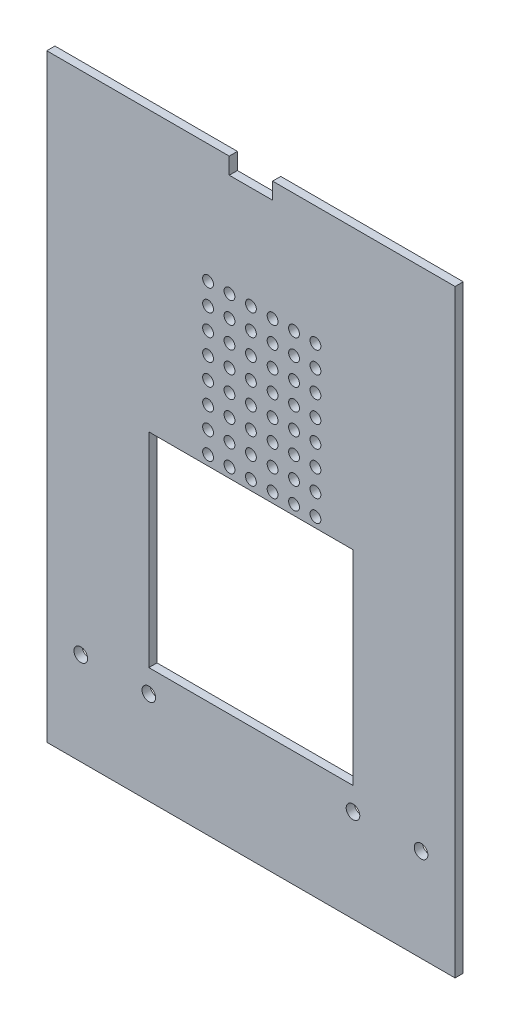
from build123d import *

# Parameters (mm, degrees)
SKETCH1_W           = 152.4
SKETCH1_H           = 292.1
BOSS_EXTRUDE1_DEPTH = 3.048
SKETCH2_W           = 76.2
SKETCH2_H           = 76.2
SKETCH2_R           = 2.0193
CUT_EXTRUDE1_DEPTH  = 165.761442103
SKETCH4_W           = 152.4
SKETCH4_H           = 63.5
CUT_EXTRUDE2_DEPTH  = 165.761442103
SKETCH5_R           = 2.54
CUT_EXTRUDE3_DEPTH  = 165.761442103
SKETCH6_W           = 152.4
SKETCH6_H           = 5.08
CUT_EXTRUDE4_DEPTH  = 165.761442103


with BuildPart() as part:
    # Sketch1 → Boss-Extrude1 (new body)
    with BuildSketch(Plane.XY):
        Rectangle(SKETCH1_W, SKETCH1_H)
    extrude(amount=BOSS_EXTRUDE1_DEPTH)

    # Sketch2 → Cut-Extrude1 (cut, through all)
    with BuildSketch(Plane.XY):
        with BuildLine():
            Line((8.086894284, 99.764589505), (8.086894284, 109.0549))
            Line((8.086894284, 109.0549), (-8.086894284, 109.0549))
            Line((-8.086894284, 109.0549), (-8.086894284, 99.764589505))
            ThreePointArc((-8.086894284, 99.764589505), (-10.7315, 92.71), (-8.086894284, 85.655410495))
            Line((-8.086894284, 85.655410495), (-8.086894284, 76.3651))
            Line((-8.086894284, 76.3651), (8.086894284, 76.3651))
            Line((8.086894284, 76.3651), (8.086894284, 85.655410495))
            ThreePointArc((8.086894284, 85.655410495), (10.7315, 92.71), (8.086894284, 99.764589505))
        make_face()
        with Locations((0, -59.69)):
            Rectangle(SKETCH2_W, SKETCH2_H)
        with Locations((0, 38.1)):
            Circle(SKETCH2_R)
        with Locations((0, 30.1)):
            Circle(SKETCH2_R)
        with Locations((0, 22.1)):
            Circle(SKETCH2_R)
        with Locations((0, 14.1)):
            Circle(SKETCH2_R)
        with Locations((0, 6.1)):
            Circle(SKETCH2_R)
        with Locations((0, -1.9)):
            Circle(SKETCH2_R)
        with Locations((0, -9.9)):
            Circle(SKETCH2_R)
        with Locations((0, -17.9)):
            Circle(SKETCH2_R)
        with Locations((-8, 38.1)):
            Circle(SKETCH2_R)
        with Locations((-16, 38.1)):
            Circle(SKETCH2_R)
        with Locations((-8, 30.1)):
            Circle(SKETCH2_R)
        with Locations((-16, 30.1)):
            Circle(SKETCH2_R)
        with Locations((-8, 22.1)):
            Circle(SKETCH2_R)
        with Locations((-16, 22.1)):
            Circle(SKETCH2_R)
        with Locations((-8, 14.1)):
            Circle(SKETCH2_R)
        with Locations((-16, 14.1)):
            Circle(SKETCH2_R)
        with Locations((-8, 6.1)):
            Circle(SKETCH2_R)
        with Locations((-16, 6.1)):
            Circle(SKETCH2_R)
        with Locations((-8, -1.9)):
            Circle(SKETCH2_R)
        with Locations((-16, -1.9)):
            Circle(SKETCH2_R)
        with Locations((-8, -9.9)):
            Circle(SKETCH2_R)
        with Locations((-16, -9.9)):
            Circle(SKETCH2_R)
        with Locations((-8, -17.9)):
            Circle(SKETCH2_R)
        with Locations((-16, -17.9)):
            Circle(SKETCH2_R)
        with Locations((24.086894284, 14.1)):
            Circle(SKETCH2_R)
        with Locations((8.086894284, 14.1)):
            Circle(SKETCH2_R)
        with Locations((8.086894284, -17.9)):
            Circle(SKETCH2_R)
        with Locations((24.086894284, 6.1)):
            Circle(SKETCH2_R)
        with Locations((16.086894284, 6.1)):
            Circle(SKETCH2_R)
        with Locations((8.086894284, -1.9)):
            Circle(SKETCH2_R)
        with Locations((8.086894284, 30.1)):
            Circle(SKETCH2_R)
        with Locations((24.086894284, 22.1)):
            Circle(SKETCH2_R)
        with Locations((24.086894284, -1.9)):
            Circle(SKETCH2_R)
        with Locations((24.086894284, -9.9)):
            Circle(SKETCH2_R)
        with Locations((8.086894284, 6.1)):
            Circle(SKETCH2_R)
        with Locations((16.086894284, 22.1)):
            Circle(SKETCH2_R)
        with Locations((8.086894284, 22.1)):
            Circle(SKETCH2_R)
        with Locations((8.086894284, -9.9)):
            Circle(SKETCH2_R)
        with Locations((24.086894284, -17.9)):
            Circle(SKETCH2_R)
        with Locations((16.086894284, 14.1)):
            Circle(SKETCH2_R)
        with Locations((16.086894284, -17.9)):
            Circle(SKETCH2_R)
        with Locations((16.086894284, 30.1)):
            Circle(SKETCH2_R)
        with Locations((24.086894284, 30.1)):
            Circle(SKETCH2_R)
        with Locations((16.086894284, -9.9)):
            Circle(SKETCH2_R)
        with Locations((16.086894284, -1.9)):
            Circle(SKETCH2_R)
        with Locations((16.086894284, 38.1)):
            Circle(SKETCH2_R)
        with Locations((8.086894284, 38.1)):
            Circle(SKETCH2_R)
        with Locations((24.086894284, 38.1)):
            Circle(SKETCH2_R)
    extrude(amount=CUT_EXTRUDE1_DEPTH, mode=Mode.SUBTRACT)

    # Sketch4 → Cut-Extrude2 (cut, through all)
    with BuildSketch(Plane.XY):
        with Locations((0, 114.3)):
            Rectangle(SKETCH4_W, SKETCH4_H)
    extrude(amount=CUT_EXTRUDE2_DEPTH, mode=Mode.SUBTRACT)

    # Sketch5 → Cut-Extrude3 (cut, through all)
    with BuildSketch(Plane(origin=(0, 0, 0), x_dir=(-1, 0, 0), z_dir=(0, 0, -1))):
        with Locations((-38.1, -106.299)):
            Circle(SKETCH5_R)
        with Locations((-63.5, -106.299)):
            Circle(SKETCH5_R)
        with Locations((63.5, -106.299)):
            Circle(SKETCH5_R)
        with Locations((38.1, -106.299)):
            Circle(SKETCH5_R)
    extrude(amount=-CUT_EXTRUDE3_DEPTH, mode=Mode.SUBTRACT)

    # Sketch6 → Cut-Extrude4 (cut, through all)
    with BuildSketch(Plane(origin=(0, 0, 0), x_dir=(-1, 0, 0), z_dir=(0, 0, -1))):
        with Locations((0, -143.51)):
            Rectangle(SKETCH6_W, SKETCH6_H)
    extrude(amount=-CUT_EXTRUDE4_DEPTH, mode=Mode.SUBTRACT)


solid = part.part
